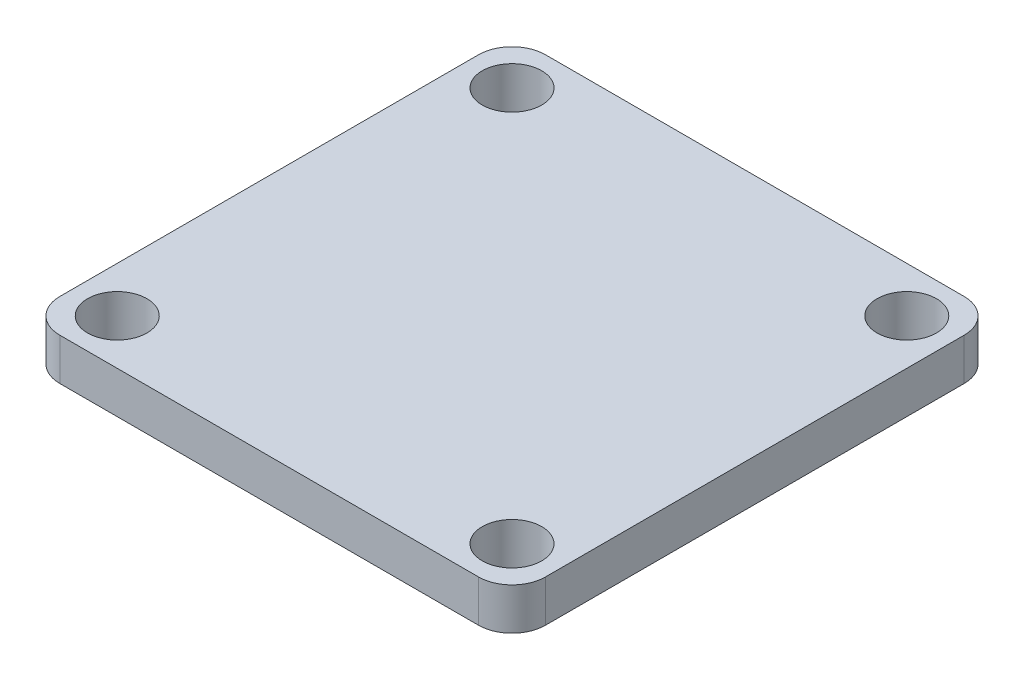
from build123d import *

# Parameters (mm, degrees)
SKETCH1_W           = 58
SKETCH1_H           = 58
SKETCH1_R           = 3.55
BOSS_EXTRUDE1_DEPTH = 5
FILLET1_R           = 4


with BuildPart() as part:
    # Sketch1 → Boss-Extrude1 (new body)
    with BuildSketch(Plane(origin=(0, 0, 0), x_dir=(1, 0, 0), z_dir=(0, 1, 0))):
        Rectangle(SKETCH1_W, SKETCH1_H)
        with Locations((-23.57, 23.57)):
            Circle(SKETCH1_R, mode=Mode.SUBTRACT)
        with Locations((23.57, 23.57)):
            Circle(SKETCH1_R, mode=Mode.SUBTRACT)
        with Locations((23.57, -23.57)):
            Circle(SKETCH1_R, mode=Mode.SUBTRACT)
        with Locations((-23.57, -23.57)):
            Circle(SKETCH1_R, mode=Mode.SUBTRACT)
    extrude(amount=BOSS_EXTRUDE1_DEPTH)

    # Fillet1
    fillet1_edges = [part.edges().sort_by_distance(p)[0] for p in [
        (-29, 2.5, 29),
        (29, 2.5, 29),
        (29, 2.5, -29),
        (-29, 2.5, -29),
    ]]
    fillet(fillet1_edges, radius=FILLET1_R)


solid = part.part
